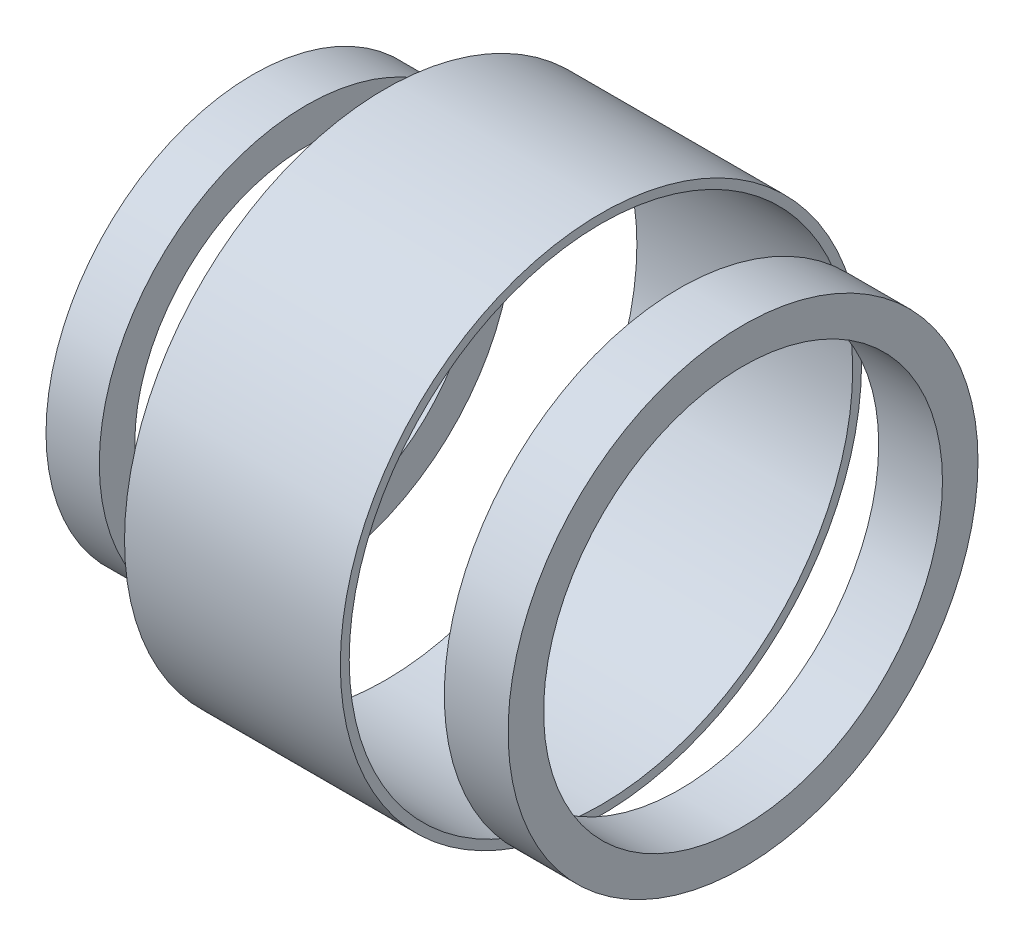
from build123d import *

# Parameters (mm, degrees)
SKETCH1_W   = 5.7
SKETCH1_H   = 3.175
SKETCH1_W_2 = 4.7625
SKETCH2_W   = 19.287499954
SKETCH2_H   = 0.79375


with BuildPart() as part:
    # Sketch1 → Revolve1 (revolve)
    with BuildSketch(Plane.XY):
        with Locations((-70.76250008, 19.412500037)):
            Rectangle(SKETCH1_W, SKETCH1_H)
        with Locations((-109.33125008, 16.912499957)):
            Rectangle(SKETCH1_W_2, SKETCH1_H)
    revolve(axis=Axis((25.71622857, 0, 0), (-1, 0, 0)))


with BuildPart() as body_2:
    # Sketch2 → Revolve2 (revolve)
    with BuildSketch(Plane(origin=(0, 0, 0), x_dir=(1, 0, 0), z_dir=(0, 1, 0))):
        with Locations((-90.256250057, 22.896875)):
            Rectangle(SKETCH2_W, SKETCH2_H)
    revolve(axis=Axis((-121.060937532, 0, 0), (1, 0, 0)))


solid = Compound([part.part, body_2.part])
